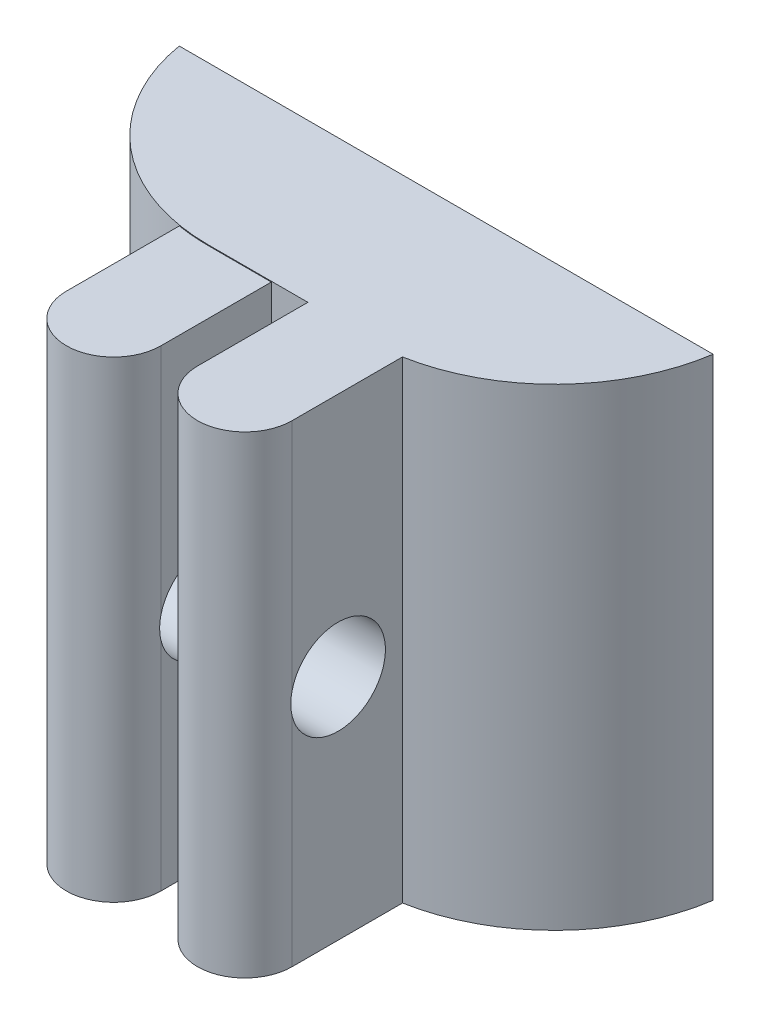
from build123d import *

# Parameters (mm, degrees)
SKETCH1_W               = 17
SKETCH1_H               = 15
BOSS_EXTRUDE1_DEPTH     = 5
SKETCH2_W               = 3
SKETCH2_H               = 15
SKETCH2_H_2             = 14.97636143
BOSS_EXTRUDE2_DEPTH     = 5
CUT_EXTRUDE2_DEPTH      = 21.185301583
CUT_EXTRUDE2_DEPTH_BACK = 21.185301583
SKETCH4_R               = 1.5
FILLET1_R               = 6
FILLET3_RADIUS          = 1.5
FILLET3_LENGTH          = 14.97636143
FILLET4_RADIUS          = 1.5
FILLET4_LENGTH          = 15


with BuildPart() as part:
    # Sketch1 → Boss-Extrude1 (new body)
    with BuildSketch(Plane.XY):
        with Locations((-8.5, -7.5)):
            Rectangle(SKETCH1_W, SKETCH1_H)
    extrude(amount=BOSS_EXTRUDE1_DEPTH)

    # Sketch2 → Boss-Extrude2 (add)
    with BuildSketch(Plane.XY.offset(5)):
        with Locations((-6.42, -7.5)):
            Rectangle(SKETCH2_W, SKETCH2_H)
        with Locations((-10.58, -7.511819285)):
            Rectangle(SKETCH2_W, SKETCH2_H_2)
    extrude(amount=BOSS_EXTRUDE2_DEPTH)

    # Sketch4 → Cut-Extrude2 (cut, two sides: drawn at the far end of the back side and taken through both)
    with BuildSketch(Plane(origin=(-9.08, 0, 0), x_dir=(0, 0, -1), z_dir=(1, 0, 0)).offset(-CUT_EXTRUDE2_DEPTH_BACK)):
        with Locations(Location((-7.041389116, -7.762480296, 0), (0, 0, 270))):
            Circle(SKETCH4_R)
    extrude(amount=CUT_EXTRUDE2_DEPTH + CUT_EXTRUDE2_DEPTH_BACK, mode=Mode.SUBTRACT)

    # Fillet1
    # the kernel refuses this fillet: 6 mm, written as the material it takes off along each edge
    with BuildSketch(Plane(origin=(0, -29.754999153, 5), x_dir=(0, 0, -1), z_dir=(0, 1, 0))) as fillet1_piece_1:
        with BuildLine():
            CenterArc((5.901999661, 6), FILLET1_R, 190.369759805, 79.630240195)
            Line((0, 4.92), (0, 0))
            Line((0, 0), (5.901999661, 0))
        make_face()
    extrude(amount=44.509998306, mode=Mode.SUBTRACT)
    # the kernel refuses this fillet: 6 mm, written as the material it takes off along each edge
    with BuildSketch(Plane(origin=(-17, 14.790199458, 5), x_dir=(0, 0, -1), z_dir=(0, -1, 0))) as fillet1_2_piece_1_section:
        with BuildLine():
            CenterArc((6, 5.916079783), FILLET1_R, 180, 80.405931773)
            Line((0, 5.916079783), (0, 0))
            Line((0, 0), (5, 0))
        make_face()
    fillet1_2_piece_1 = extrude(amount=44.580398916, mode=Mode.PRIVATE)
    fillet1_2_piece_1 = split(fillet1_2_piece_1, bisect_by=Plane(origin=(-17, -0.02363857, 5), z_dir=(0, 1, 0)), keep=Keep.TOP, mode=Mode.PRIVATE)
    fillet1_2_piece_1 = split(fillet1_2_piece_1, bisect_by=Plane(origin=(-12.08, 14.790199458, 5), z_dir=(-1, 0, 0)), keep=Keep.TOP, mode=Mode.PRIVATE)
    add(fillet1_2_piece_1, mode=Mode.SUBTRACT)
    with BuildSketch(Plane(origin=(-17, 14.790199458, 5), x_dir=(0, 0, -1), z_dir=(0, -1, 0))) as fillet1_2_piece_2_section:
        with BuildLine():
            CenterArc((6, 5.916079783), FILLET1_R, 180, 80.405931773)
            Line((0, 5.916079783), (0, 0))
            Line((0, 0), (5, 0))
        make_face()
    fillet1_2_piece_2 = extrude(amount=44.580398916, mode=Mode.PRIVATE)
    fillet1_2_piece_2 = split(fillet1_2_piece_2, bisect_by=Plane(origin=(-17, -0.02363857, 5), z_dir=(0, 1, 0)), keep=Keep.TOP, mode=Mode.PRIVATE)
    fillet1_2_piece_2 = split(fillet1_2_piece_2, bisect_by=Plane(origin=(-12.08, 14.790199458, 5), z_dir=(1, 0, 0)), keep=Keep.TOP, mode=Mode.PRIVATE)
    add(fillet1_2_piece_2, mode=Mode.SUBTRACT)
    with BuildSketch(Plane(origin=(-17, 14.790199458, 5), x_dir=(0, 0, -1), z_dir=(0, -1, 0))) as fillet1_2_piece_3_section:
        with BuildLine():
            CenterArc((6, 5.916079783), FILLET1_R, 180, 80.405931773)
            Line((0, 5.916079783), (0, 0))
            Line((0, 0), (5, 0))
        make_face()
    fillet1_2_piece_3 = extrude(amount=44.580398916, mode=Mode.PRIVATE)
    fillet1_2_piece_3 = split(fillet1_2_piece_3, bisect_by=Plane(origin=(-17, -0.02363857, 5), z_dir=(0, -1, 0)), keep=Keep.TOP, mode=Mode.PRIVATE)
    fillet1_2_piece_3 = split(fillet1_2_piece_3, bisect_by=Plane(origin=(-12.08, 14.790199458, 5), z_dir=(-1, 0, 0)), keep=Keep.TOP, mode=Mode.PRIVATE)
    add(fillet1_2_piece_3, mode=Mode.SUBTRACT)

    # Fillet3: full round fillet: the end face becomes a half cylinder, R = half its width
    fillet3_face = Plane((-10.58, -7.511819285, 10), x_dir=(0, -1, 0), z_dir=(0, 0, 1))  # on the end face: x along it, z out of the body
    fillet3_slab = fillet3_face.offset(-FILLET3_RADIUS / 2) * Box(FILLET3_LENGTH, 2 * FILLET3_RADIUS, FILLET3_RADIUS, mode=Mode.PRIVATE)  # the body's end, R deep
    fillet3_round = Plane((-10.58, -7.511819285, 8.5), x_dir=(0, 0, 1), z_dir=(0, -1, 0)) * Cylinder(FILLET3_RADIUS, FILLET3_LENGTH, mode=Mode.PRIVATE)  # its axis R under the face
    add(fillet3_slab - fillet3_round, mode=Mode.SUBTRACT)

    # Fillet4: full round fillet: the end face becomes a half cylinder, R = half its width
    fillet4_face = Plane((-6.42, -7.5, 10), x_dir=(0, -1, 0), z_dir=(0, 0, 1))  # on the end face: x along it, z out of the body
    fillet4_slab = fillet4_face.offset(-FILLET4_RADIUS / 2) * Box(FILLET4_LENGTH, 2 * FILLET4_RADIUS, FILLET4_RADIUS, mode=Mode.PRIVATE)  # the body's end, R deep
    fillet4_round = Plane((-6.42, -7.5, 8.5), x_dir=(0, 0, 1), z_dir=(0, -1, 0)) * Cylinder(FILLET4_RADIUS, FILLET4_LENGTH, mode=Mode.PRIVATE)  # its axis R under the face
    add(fillet4_slab - fillet4_round, mode=Mode.SUBTRACT)


solid = part.part
